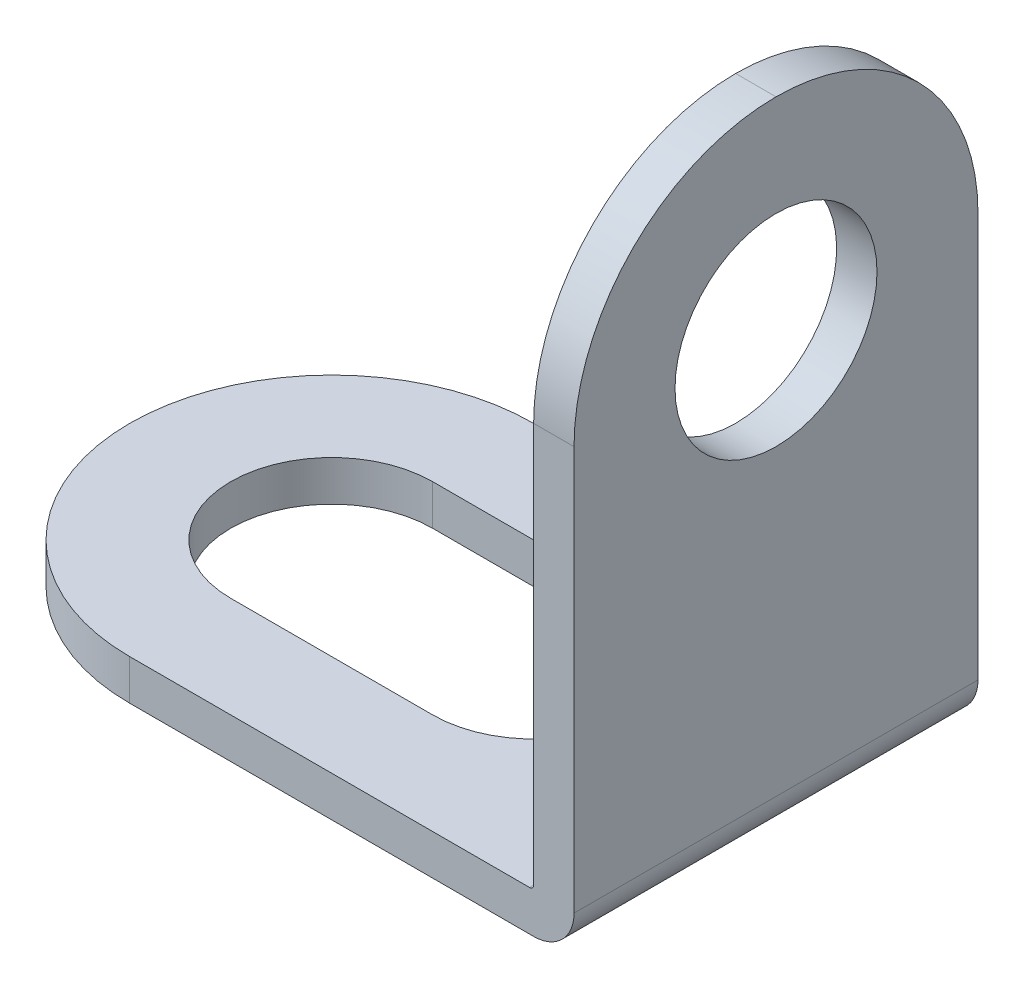
from build123d import *

# Parameters (mm, degrees)
LINEAR_AUSTRAGEN_D_NN1_DEPTH    = 5
VERRUNDUNG1_R                   = 5
VERRUNDUNG2_R                   = 1
VERRUNDUNG3_R                   = 0.1
SKIZZE2_R                       = 2.5
SCHNITT_LINEAR_AUSTRAGEN1_DEPTH = 10
SCHNITT_LINEAR_AUSTRAGEN2_DEPTH = 10


with BuildPart() as part:
    # Skizze1 → Linear-Austragen-Dünn1 (new, symmetric)
    with BuildSketch(Plane.XY):
        Polygon((0, 15), (0, 0), (-15, 0), (-15, -1), (1, -1), (1, 15), align=None)
    extrude(amount=LINEAR_AUSTRAGEN_D_NN1_DEPTH, both=True)

    # Verrundung1
    verrundung1_edges = [part.edges().sort_by_distance(p)[0] for p in [
        (-15, -0.5, -5),
        (-15, -0.5, 5),
        (0.5, 15, -5),
        (0.5, 15, 5),
    ]]
    fillet(verrundung1_edges, radius=VERRUNDUNG1_R - 0.0001)  # a hair under: the kernel refuses the full size

    # Verrundung2
    verrundung2_edges = [part.edges().sort_by_distance(p)[0] for p in [
        (1, -1, 0),
    ]]
    fillet(verrundung2_edges, radius=VERRUNDUNG2_R)

    # Verrundung3
    verrundung3_edges = [part.edges().sort_by_distance(p)[0] for p in [
        (0, 0, 0),
    ]]
    fillet(verrundung3_edges, radius=VERRUNDUNG3_R)

    # Skizze2 → Schnitt-Linear austragen1 (cut)
    with BuildSketch(Plane.ZY):
        with Locations(Location((0, 10, 0), (0, 0, 270))):
            Circle(SKIZZE2_R)
    extrude(amount=-SCHNITT_LINEAR_AUSTRAGEN1_DEPTH, mode=Mode.SUBTRACT)

    # Skizze3 → Schnitt-Linear austragen2 (cut)
    with BuildSketch(Plane(origin=(0, 0, 0), x_dir=(1, 0, 0), z_dir=(0, 1, 0))):
        with BuildLine():
            Line((-10, 2.5), (-5, 2.5))
            ThreePointArc((-5, 2.5), (-2.5, 0), (-5, -2.5))
            Line((-5, -2.5), (-10, -2.5))
            ThreePointArc((-10, -2.5), (-12.5, 0), (-10, 2.5))
        make_face()
    extrude(amount=-SCHNITT_LINEAR_AUSTRAGEN2_DEPTH, mode=Mode.SUBTRACT)


solid = part.part
